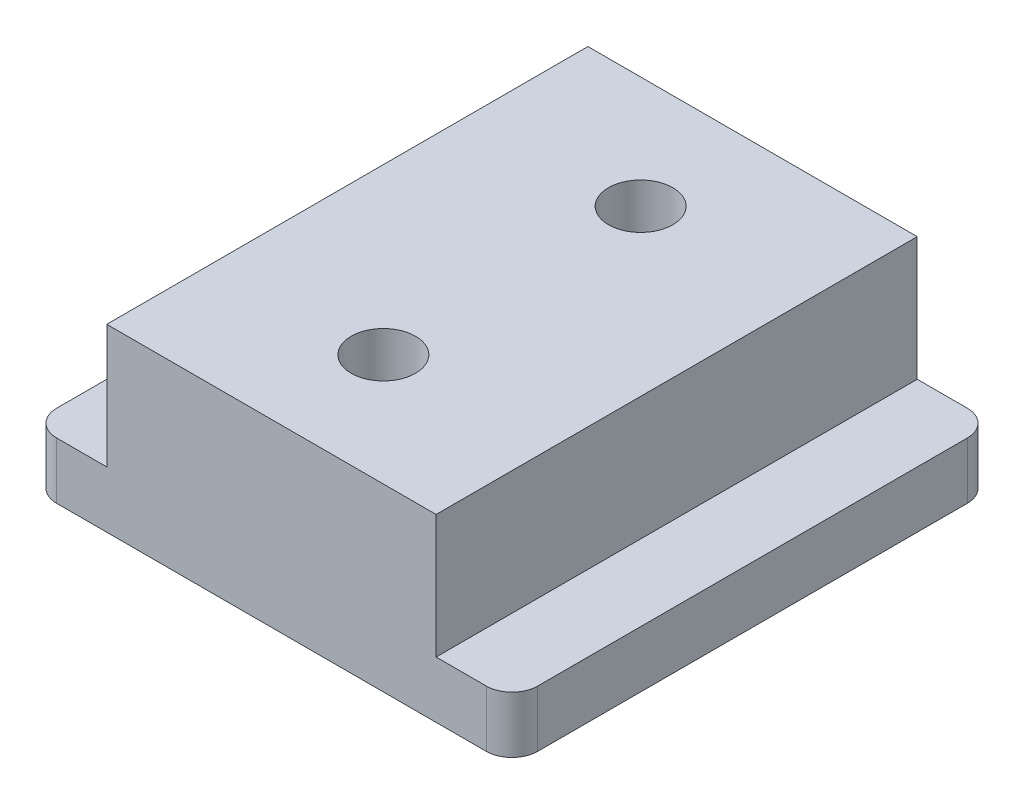
from build123d import *

# Parameters (mm, degrees)
EXTRUDE_1_DEPTH     = 2.2
EXTRUDE_1_2_DEPTH   = 2.2
SKETCH_1_3_W        = 12.8
SKETCH_1_3_H        = 18.7
SKETCH_1_3_R        = 1.25
EXTRUDE_2_DEPTH     = 7
SKETCH_1_4_R        = 2.5
SKETCH_1_4_R_2      = 1.25
CUT_EXTRUDE_1_DEPTH = 2.2
FILLET_1_R          = 2


with BuildPart() as part:
    # 草图1 → 凸台-拉伸1 (new body)
    with BuildSketch(Plane(origin=(0, 0, 0), x_dir=(1, 0, 0), z_dir=(0, 1, 0))):
        with BuildLine():
            Line((-6.4, 9.35), (-8.35, 9.35))
            ThreePointArc((-8.35, 9.35), (-9.057106781, 9.057106781), (-9.35, 8.35))
            Line((-9.35, 8.35), (-9.35, -8.35))
            ThreePointArc((-9.35, -8.35), (-9.057106781, -9.057106781), (-8.35, -9.35))
            Line((-8.35, -9.35), (-6.4, -9.35))
            Line((-6.4, -9.35), (-6.4, 9.35))
        make_face()
    extrude(amount=EXTRUDE_1_DEPTH)



with BuildPart() as body_2:
    # 草图1 → Extrude 1 2 (new body)
    with BuildSketch(Plane(origin=(0, 0, 0), x_dir=(1, 0, 0), z_dir=(0, 1, 0))):
        with BuildLine():
            Line((8.35, 9.35), (6.4, 9.35))
            Line((6.4, 9.35), (6.4, -9.35))
            Line((6.4, -9.35), (8.35, -9.35))
            ThreePointArc((8.35, -9.35), (9.057106781, -9.057106781), (9.35, -8.35))
            Line((9.35, -8.35), (9.35, 8.35))
            ThreePointArc((9.35, 8.35), (9.057106781, 9.057106781), (8.35, 9.35))
        make_face()
    extrude(amount=EXTRUDE_1_2_DEPTH)


with BuildPart() as part_1:
    add(part.part)

    add(body_2.part)  # 凸台-拉伸2 merges body 2
    # 草图1<3> → 凸台-拉伸2 (add)
    with BuildSketch(Plane(origin=(0, 0, 0), x_dir=(1, 0, 0), z_dir=(0, 1, 0))):
        Rectangle(SKETCH_1_3_W, SKETCH_1_3_H)
        with Locations(Location((0, 5, 0), (0, 0, 270))):
            Circle(SKETCH_1_3_R, mode=Mode.SUBTRACT)
        with Locations(Location((0, -5, 0), (0, 0, 270))):
            Circle(SKETCH_1_3_R, mode=Mode.SUBTRACT)
    extrude(amount=EXTRUDE_2_DEPTH)

    # 草图1<4> → 切除-拉伸1 (cut)
    # profile 1 of 2: a face of its own
    with BuildSketch(Plane(origin=(0, 0, 0), x_dir=(1, 0, 0), z_dir=(0, 1, 0))):
        with Locations(Location((0, -5, 0), (0, 0, 270))):
            Circle(SKETCH_1_4_R)
        with Locations(Location((0, -5, 0), (0, 0, 270))):
            Circle(SKETCH_1_4_R_2, mode=Mode.SUBTRACT)
    # profile 2 of 2: a face of its own
    with BuildSketch(Plane(origin=(0, 0, 0), x_dir=(1, 0, 0), z_dir=(0, 1, 0))):
        with Locations(Location((0, 5, 0), (0, 0, 270))):
            Circle(SKETCH_1_4_R)
        with Locations(Location((0, 5, 0), (0, 0, 270))):
            Circle(SKETCH_1_4_R_2, mode=Mode.SUBTRACT)
    extrude(amount=CUT_EXTRUDE_1_DEPTH, mode=Mode.SUBTRACT)

    # 圆角1
    # the kernel refuses this fillet: 2 mm, written as the material it takes off along each edge
    with BuildSketch(Plane(origin=(0, 2.2, 5), x_dir=(0, 0, 1), z_dir=(-1, 0, 0))) as fillet_1_piece_1:
        with BuildLine():
            CenterArc((3.25, 1.854049622), FILLET_1_R, 180, 67.975687163)
            Line((2.5, 0), (2.485, -0.037080992))
            ThreePointArc((2.485, -0.037080992), (1.875, -0.04), (1.25, -0.04))
            Line((1.25, -0.04), (1.21, 0))
            Line((1.21, 0), (1.21, 1.854049622))
            Line((1.21, 1.854049622), (1.25, 1.854049622))
        make_face()
    revolve(axis=Axis((0, 2.2, 5), (0, 1, 0)), mode=Mode.SUBTRACT)
    with BuildSketch(Plane(origin=(0, 2.2, -5), x_dir=(0, 0, 1), z_dir=(-1, 0, 0))) as fillet_1_piece_2:
        with BuildLine():
            CenterArc((3.25, 1.854049622), FILLET_1_R, 180, 67.975687163)
            Line((2.5, 0), (2.485, -0.037080992))
            ThreePointArc((2.485, -0.037080992), (1.875, -0.04), (1.25, -0.04))
            Line((1.25, -0.04), (1.21, 0))
            Line((1.21, 0), (1.21, 1.854049622))
            Line((1.21, 1.854049622), (1.25, 1.854049622))
        make_face()
    revolve(axis=Axis((0, 2.2, -5), (0, 1, 0)), mode=Mode.SUBTRACT)


solid = part_1.part
